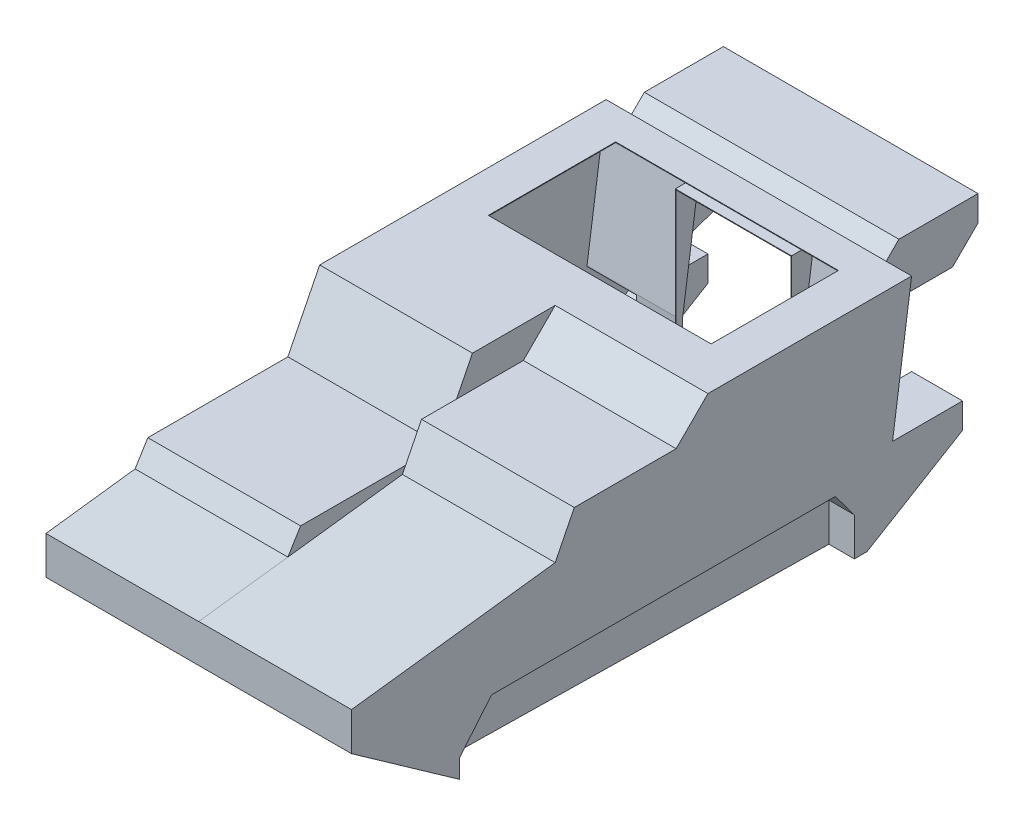
from build123d import *

# Parameters (mm, degrees)
BOSS_EXTRUDE1_DEPTH      = 609.6
BOSS_EXTRUDE2_DEPTH      = 609.6
BOSS_EXTRUDE4_DEPTH      = 508
BOSS_EXTRUDE4_DEPTH_BACK = 508
SKETCH4_W                = 812.8
SKETCH4_H                = 558.8
CUT_EXTRUDE1_DEPTH       = 1464.754200677
CUT_EXTRUDE2_DEPTH       = 2295.732210956
CUT_EXTRUDE2_DEPTH_BACK  = 25.4
SKETCH5_W                = 458.358099056
SKETCH5_H                = 619.720514452
SHELL2_START             = -505.46
SHELL2_DEPTH             = 1010.92
SHELL2_START_2           = -607.06
SHELL2_2_DEPTH           = 1214.12
SHELL2_3_DEPTH           = 604.52
SHELL2_START_3           = 408.94
SHELL2_4_DEPTH           = 198.12
SHELL2_5_DEPTH           = 198.12
SHELL2_START_4           = 231.719049528
SHELL2_6_DEPTH           = 177.220950472
SHELL2_START_5           = -408.94
SHELL2_7_DEPTH           = 177.220950472
SHELL2_START_6           = 2.54
SHELL2_8_DEPTH           = 229.179049528
BOSS_EXTRUDE5_DEPTH      = 508
BOSS_EXTRUDE5_DEPTH_BACK = 508
BOSS_EXTRUDE6_DEPTH      = 76.2
CUT_EXTRUDE3_REACH       = 1742.311
SKETCH9_W                = 889
SKETCH9_H                = 508


# Read off the part's stored shape, not the designer's step: Shell2
with BuildPart() as part:
    # Left Side → Boss-Extrude1 (new body)
    with BuildSketch(Plane(origin=(0, 0, 0), x_dir=(0, 0, -1), z_dir=(1, 0, 0))):
        Polygon((-787.4, -381), (-787.4, -457.2), (-1219.2, -152.4), (-1219.2, 0), (-406.4, 101.6), (-330.2, 254), (76.2, 254), (203.2, 381), (1016, 381), (939.8, -152.4), (1219.2, -152.4), (1219.2, -254), (838.2, -482.6), (787.4, -482.6), (787.4, -330.2), (711.2, -228.6), (-660.4, -228.6), align=None)
    extrude(amount=BOSS_EXTRUDE1_DEPTH)

    # Sketch1 → Boss-Extrude2 (add)
    with BuildSketch(Plane(origin=(0, 0, 0), x_dir=(0, 0, -1), z_dir=(1, 0, 0))):
        Polygon((-787.4, -381), (-787.4, -457.2), (-1219.2, -152.4), (-1219.2, -0.718940146), (-863.6, 44.45), (-812.8, 127), (-254, 127), (-127, 381), (1016, 381), (939.8, -152.4), (1219.2, -152.4), (1219.2, -254), (838.2, -482.6), (787.4, -482.6), (787.4, -330.2), (711.2, -228.6), (-660.4, -228.6), align=None)
    extrude(amount=-BOSS_EXTRUDE2_DEPTH)

    # Sketch3 → Boss-Extrude4 (add, two sides: drawn at the far end of the back side and taken through both)
    with BuildSketch(Plane(origin=(0, 0, 0), x_dir=(0, 0, -1), z_dir=(1, 0, 0)).offset(-BOSS_EXTRUDE4_DEPTH_BACK)):
        Polygon((-787.4, -457.2), (787.4, -482.6), (787.4, -330.2), (711.2, -228.6), (-660.4, -228.6), (-787.4, -381), align=None)
    extrude(amount=BOSS_EXTRUDE4_DEPTH + BOSS_EXTRUDE4_DEPTH_BACK)

    # Sketch4 → Cut-Extrude1 (cut, through all)
    with BuildSketch(Plane(origin=(0, -152.4, 0), x_dir=(1, 0, 0), z_dir=(0, 1, 0))):
        with Locations((0, 1219.2)):
            Rectangle(SKETCH4_W, SKETCH4_H)
    extrude(amount=-CUT_EXTRUDE1_DEPTH, mode=Mode.SUBTRACT)

    # Sketch5 → Cut-Extrude2 (cut, two sides: drawn at the far end of the back side and taken through both)
    with BuildSketch(Plane(origin=(0, 0, -939.8), x_dir=(-1, 0, 0), z_dir=(0, 0, -1)).offset(-CUT_EXTRUDE2_DEPTH_BACK)):
        Rectangle(SKETCH5_W, SKETCH5_H)
    extrude(amount=CUT_EXTRUDE2_DEPTH + CUT_EXTRUDE2_DEPTH_BACK, mode=Mode.SUBTRACT)

    # Shell2 outline → Shell2 (cut)
    with BuildSketch(Plane.YZ.offset(SHELL2_START)):
        Polygon((312.400257226, -914.4), (312.400257226, -1003.634249283), (378.46, -1013.071355394), (378.46, -204.252102448), (251.46, -77.252102448), (251.46, 188.930193669), (124.46, 252.430193669), (124.46, 392.130193669), (99.248222887, 404.736082225), (41.929927698, 863.282443734), (-2.956713718, 1216.66), (-151.083883753, 1216.66), (-454.672968619, 786.575463107), (-480.06, -787.420482539), (-480.06, -837.496460729), (-420.201876437, -937.26), (-312.400257226, -937.26), (-312.400257226, -914.4), align=None)
    extrude(amount=SHELL2_DEPTH, mode=Mode.SUBTRACT)

    # Shell2 2 outline → Shell2 2 (cut)
    with BuildSketch(Plane.YZ.offset(SHELL2_START_2)):
        Polygon((312.400257226, -914.4), (312.400257226, -1003.634249283), (378.46, -1013.071355394), (378.46, -204.252102448), (251.46, -77.252102448), (251.46, 188.930193669), (124.46, 252.430193669), (124.46, 392.130193669), (99.248222887, 404.736082225), (41.929927698, 863.282443734), (-2.956713718, 1216.66), (-151.083883753, 1216.66), (-452.2980014, 789.94), (-380.080393165, 789.94), (-226.06, 661.589672363), (-226.06, -712.47), (-329.353333333, -789.94), (-480.06, -789.94), (-480.06, -837.496460729), (-420.201876437, -937.26), (-312.400257226, -937.26), (-312.400257226, -914.4), align=None)
    extrude(amount=SHELL2_2_DEPTH, mode=Mode.SUBTRACT)

    # Shell2 3 outline → Shell2 3 (cut)
    with BuildSketch(Plane.YZ.offset(SHELL2_START_2)):
        Polygon((378.46, 125.430193669), (251.46, 188.930193669), (251.46, -77.252102448), (378.46, -204.252102448), align=None)
        Polygon((99.248222887, 404.736082225), (124.46, 392.130193669), (124.46, 811.380660207), (42.083435134, 862.073930894), (41.929927698, 863.282443734), align=None)
    extrude(amount=SHELL2_3_DEPTH, mode=Mode.SUBTRACT)

    # Shell2 4 outline → Shell2 4 (cut)
    with BuildSketch(Plane.YZ.offset(SHELL2_START_3)):
        Polygon((-154.94, -937.26), (-152.219487758, -937.26), (312.400257226, -1003.634249283), (312.400257226, -914.4), (-312.400257226, -914.4), (-312.400257226, -937.26), (-420.201876437, -937.26), (-252.561876437, -1216.66), (-154.94, -1216.66), align=None)
        Polygon((124.46, 252.430193669), (251.46, 188.930193669), (251.46, 328.630193669), (124.46, 392.130193669), align=None)
        Polygon((-2.242266835, 1216.66), (-2.956713718, 1216.66), (41.929927698, 863.282443734), align=None)
    extrude(amount=SHELL2_4_DEPTH, mode=Mode.SUBTRACT)

    # Shell2 5 outline → Shell2 5 (cut)
    with BuildSketch(Plane.YZ.offset(SHELL2_START_2)):
        Polygon((-154.94, -937.26), (-152.219487758, -937.26), (312.400257226, -1003.634249283), (312.400257226, -914.4), (-312.400257226, -914.4), (-312.400257226, -937.26), (-420.201876437, -937.26), (-252.561876437, -1216.66), (-154.94, -1216.66), align=None)
    extrude(amount=SHELL2_5_DEPTH, mode=Mode.SUBTRACT)

    # Shell2 6 outline → Shell2 6 (cut)
    with BuildSketch(Plane.YZ.offset(SHELL2_START_4)):
        Polygon((-312.400257226, -937.26), (-152.219487758, -937.26), (312.400257226, -1003.634249283), (312.400257226, -914.4), (-312.400257226, -914.4), align=None)
        Polygon((124.46, 252.430193669), (251.46, 188.930193669), (251.46, 328.630193669), (124.46, 392.130193669), align=None)
        Polygon((-2.242266835, 1216.66), (-2.956713718, 1216.66), (41.929927698, 863.282443734), align=None)
    extrude(amount=SHELL2_6_DEPTH, mode=Mode.SUBTRACT)

    # Shell2 7 outline → Shell2 7 (cut)
    with BuildSketch(Plane.YZ.offset(SHELL2_START_5)):
        Polygon((-312.400257226, -937.26), (-152.219487758, -937.26), (312.400257226, -1003.634249283), (312.400257226, -914.4), (-312.400257226, -914.4), align=None)
    extrude(amount=SHELL2_7_DEPTH, mode=Mode.SUBTRACT)

    # Shell2 8 outline → Shell2 8 (cut)
    with BuildSketch(Plane.YZ.offset(SHELL2_START_6)):
        Polygon((124.46, 252.430193669), (251.46, 188.930193669), (251.46, 328.630193669), (124.46, 392.130193669), align=None)
        Polygon((-2.242266835, 1216.66), (-2.956713718, 1216.66), (41.929927698, 863.282443734), align=None)
    extrude(amount=SHELL2_8_DEPTH, mode=Mode.SUBTRACT)

    # Sketch7 → Boss-Extrude5 (add, two sides: drawn at the far end of the back side and taken through both)
    with BuildSketch(Plane(origin=(0, 0, 0), x_dir=(0, 0, -1), z_dir=(1, 0, 0)).offset(-BOSS_EXTRUDE5_DEPTH_BACK)):
        Polygon((1016, 381), (1066.8, 431.8), (1382.485714286, 431.8), (1382.485714286, 330.2), (1280.885714286, 228.6), (1052.285714286, 228.6), (1001.485714286, 279.4), align=None)
    extrude(amount=BOSS_EXTRUDE5_DEPTH + BOSS_EXTRUDE5_DEPTH_BACK)

    # Sketch8 → Boss-Extrude6 (add)
    with BuildSketch(Plane(origin=(304.8, 0, 0), x_dir=(0, 0, -1), z_dir=(1, 0, 0))):
        Polygon((1001.485714286, 279.4), (965.2, 25.4), (1331.685714286, 152.4), (1331.685714286, 279.4), align=None)
    boss_extrude6 = extrude(amount=BOSS_EXTRUDE6_DEPTH)

    # Mirror1: Boss-Extrude6 across plane
    add(boss_extrude6.mirror(Plane(origin=(0, 0, 0), x_dir=(0, 0, 1), z_dir=(1, 0, 0))))

    # Sketch9 → Cut-Extrude3 (cut, up to next)
    with BuildSketch(Plane(origin=(0, 381, 0), x_dir=(1, 0, 0), z_dir=(0, 1, 0)), mode=Mode.PRIVATE) as cut_extrude3_sk1:
        with Locations((0, 635)):
            Rectangle(SKETCH9_W, SKETCH9_H)
    cut_extrude3_tool1 = extrude(cut_extrude3_sk1.sketch, amount=-CUT_EXTRUDE3_REACH, mode=Mode.PRIVATE) & part.part
    add(cut_extrude3_tool1.solids().sort_by_distance((0, 381, -635))[0], mode=Mode.SUBTRACT)


solid = part.part
